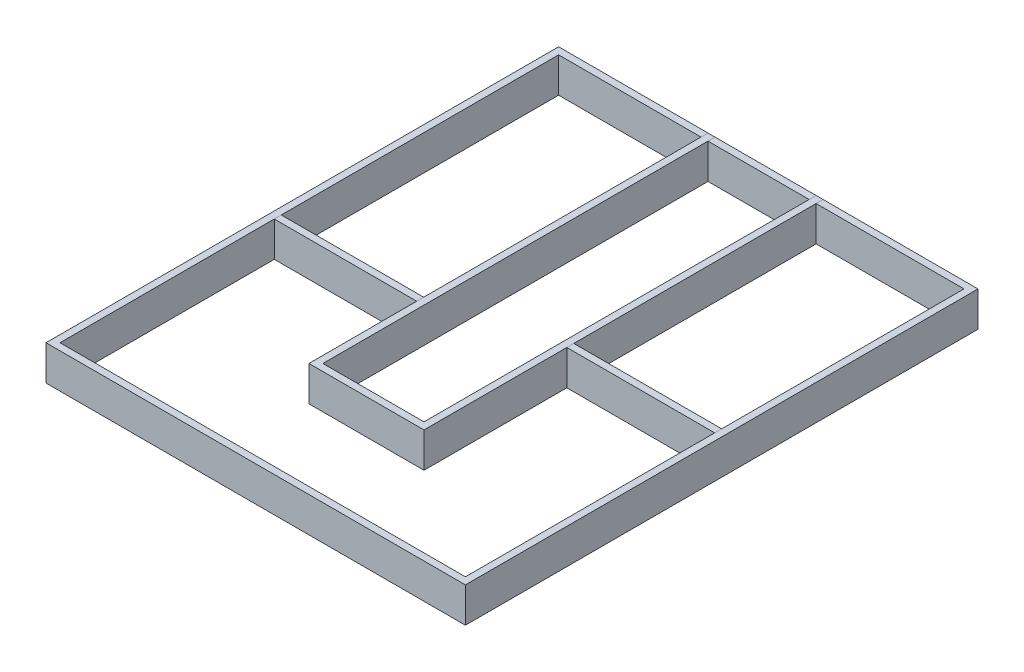
from build123d import *

# Parameters (mm, degrees)
EXTRUDE_1_DEPTH   = 15
SKETCH_1_W        = 180
SKETCH_1_H        = 220
SKETCH_1_W_2      = 174
SKETCH_1_H_2      = 214
EXTRUDE_1_2_DEPTH = 15
SKETCH_1_W_3      = 64.124178017
SKETCH_1_H_3      = 3
EXTRUDE_1_3_DEPTH = 15
SKETCH_1_W_4      = 66.47652547
EXTRUDE_1_4_DEPTH = 15


with BuildPart() as part:
    # Эскиз1 → Вытянуть-Тонкостенный1 (new body)
    with BuildSketch(Plane(origin=(0, 0, 0), x_dir=(1, 0, 0), z_dir=(0, 1, 0))):
        Polygon((-25.875821983, 110), (-25.875821983, -61.291719748), (23.52347453, -61.291719748), (23.52347453, 110), (20.52347453, 110), (20.52347453, -58.291719748), (-22.875821983, -58.291719748), (-22.875821983, 110), align=None)
    extrude(amount=EXTRUDE_1_DEPTH)


with BuildPart() as body_2:
    # Эскиз1 → Extrude 1 2 (new body)
    with BuildSketch(Plane(origin=(0, 0, 0), x_dir=(1, 0, 0), z_dir=(0, 1, 0))):
        Rectangle(SKETCH_1_W, SKETCH_1_H)
        Rectangle(SKETCH_1_W_2, SKETCH_1_H_2, mode=Mode.SUBTRACT)
    extrude(amount=EXTRUDE_1_2_DEPTH)


with BuildPart() as body_3:
    # Эскиз1 → Extrude 1 3 (new body)
    with BuildSketch(Plane(origin=(0, 0, 0), x_dir=(1, 0, 0), z_dir=(0, 1, 0))):
        with Locations((-57.937910992, -13.528886505)):
            Rectangle(SKETCH_1_W_3, SKETCH_1_H_3)
    extrude(amount=EXTRUDE_1_3_DEPTH)


with BuildPart() as body_4:
    # Эскиз1 → Extrude 1 4 (new body)
    with BuildSketch(Plane(origin=(0, 0, 0), x_dir=(1, 0, 0), z_dir=(0, 1, 0))):
        with Locations((56.761737265, 1.5)):
            Rectangle(SKETCH_1_W_4, SKETCH_1_H_3)
    extrude(amount=EXTRUDE_1_4_DEPTH)


solid = Compound([part.part, body_2.part, body_3.part, body_4.part])
